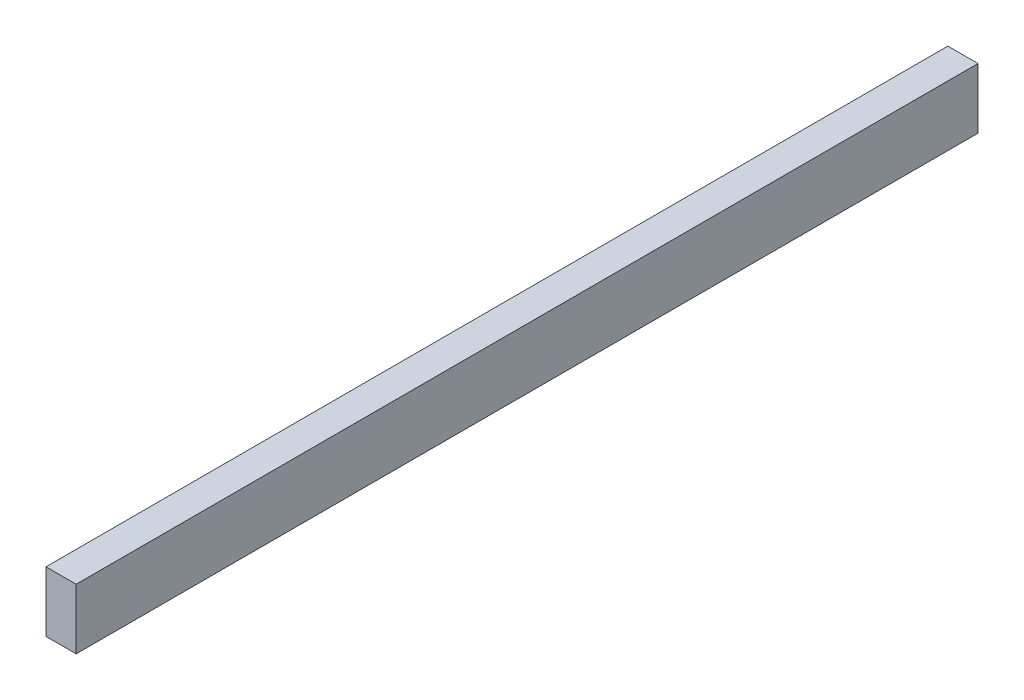
from build123d import *

# Parameters (mm, degrees)
SKETCH1_W           = 50.8
SKETCH1_H           = 101.6
BOSS_EXTRUDE1_DEPTH = 1518.68


with BuildPart() as part:
    # Sketch1 → Boss-Extrude1 (new body)
    with BuildSketch(Plane.XY):
        with Locations((25.4, 50.8)):
            Rectangle(SKETCH1_W, SKETCH1_H)
    extrude(amount=BOSS_EXTRUDE1_DEPTH)


solid = part.part
